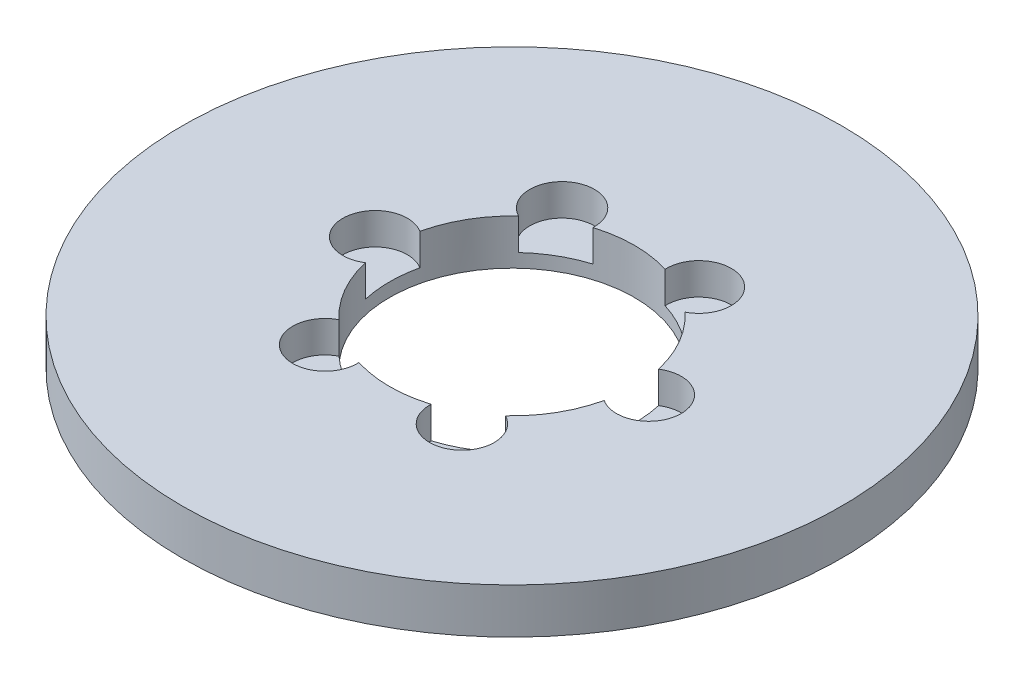
from build123d import *

# Parameters (mm, degrees)
SKETCH1_R           = 87.5
BOSS_EXTRUDE1_DEPTH = 12
SKETCH2_R           = 32.5
CUT_EXTRUDE1_DEPTH  = 125.324173032
SKETCH3_R           = 8.585635198
CUT_EXTRUDE2_DEPTH  = 8.393945631
CIRPATTERN1_COUNT   = 6


with BuildPart() as part:
    # Sketch1 → Boss-Extrude1 (new body)
    with BuildSketch(Plane(origin=(0, 0, 0), x_dir=(1, 0, 0), z_dir=(0, 1, 0))):
        Circle(SKETCH1_R)
    extrude(amount=BOSS_EXTRUDE1_DEPTH)

    # Sketch2 → Cut-Extrude1 (cut, through all)
    with BuildSketch(Plane(origin=(0, 0, 0), x_dir=(1, 0, 0), z_dir=(0, 1, 0))):
        Circle(SKETCH2_R)
    extrude(amount=CUT_EXTRUDE1_DEPTH, mode=Mode.SUBTRACT)

    # Sketch3 → Cut-Extrude2 (cut)
    with BuildSketch(Plane(origin=(0, 12, 0), x_dir=(1, 0, 0), z_dir=(0, 1, 0))):
        with Locations((-36.333600661, 0)):
            Circle(SKETCH3_R)
    cut_extrude2 = extrude(amount=-CUT_EXTRUDE2_DEPTH, mode=Mode.SUBTRACT)

    # CirPattern1: Cut-Extrude2 ×6 about axis
    cirpattern1_axis = Axis((0, 0, 0), (0, 1, 0))
    for i in range(1, CIRPATTERN1_COUNT):
        add(cut_extrude2.rotate(cirpattern1_axis, i * 360 / CIRPATTERN1_COUNT), mode=Mode.SUBTRACT)


solid = part.part
